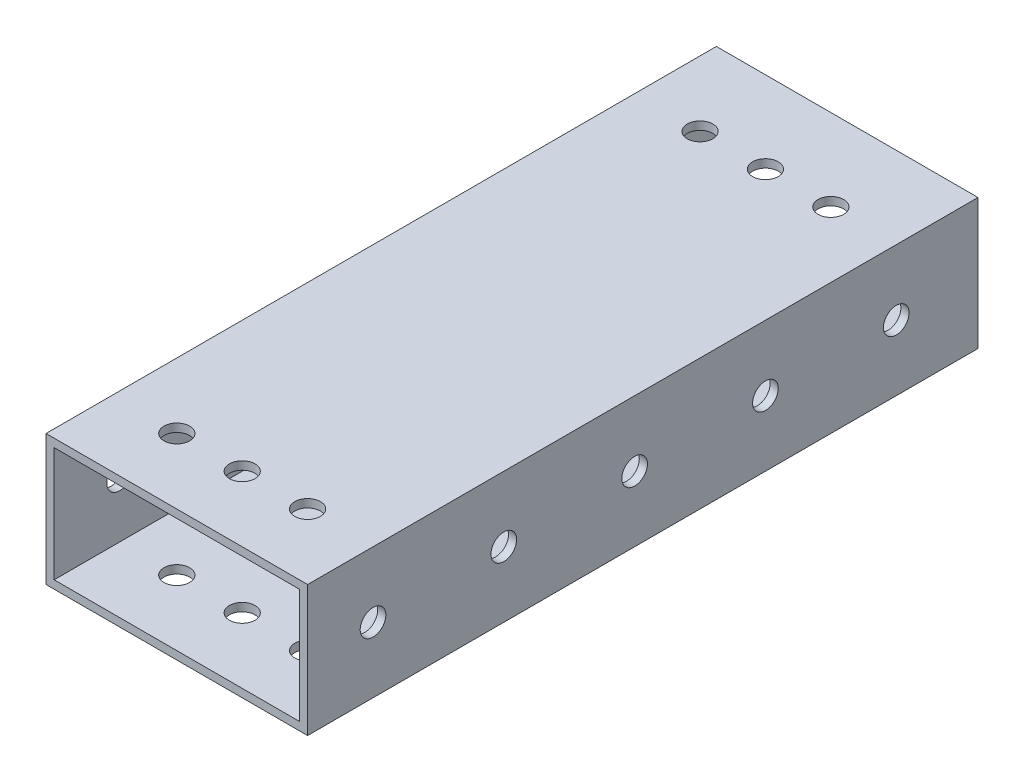
from build123d import *

# Parameters (mm, degrees)
SKETCH1_W           = 50.8
SKETCH1_H           = 25.4
SKETCH1_W_2         = 47.625
SKETCH1_H_2         = 22.225
BOSS_EXTRUDE1_DEPTH = 130.175
SKETCH2_R           = 2.4892
CUT_EXTRUDE1_DEPTH  = 136.04018152
SKETCH3_R           = 2.4892
CUT_EXTRUDE2_DEPTH  = 141.312011692


with BuildPart() as part:
    # Sketch1 → Boss-Extrude1 (new body)
    with BuildSketch(Plane.XY):
        Rectangle(SKETCH1_W, SKETCH1_H)
        Rectangle(SKETCH1_W_2, SKETCH1_H_2, mode=Mode.SUBTRACT)
    extrude(amount=BOSS_EXTRUDE1_DEPTH)

    # Sketch2 → Cut-Extrude1 (cut, through all)
    with BuildSketch(Plane(origin=(0, 12.7, 0), x_dir=(1, 0, 0), z_dir=(0, 1, 0))):
        with Locations((-12.7, -15.875)):
            Circle(SKETCH2_R)
        with Locations((0, -15.875)):
            Circle(SKETCH2_R)
        with Locations((12.7, -15.875)):
            Circle(SKETCH2_R)
        with Locations((-12.7, -117.475)):
            Circle(SKETCH2_R)
        with Locations((0, -117.475)):
            Circle(SKETCH2_R)
        with Locations((12.7, -117.475)):
            Circle(SKETCH2_R)
    extrude(amount=-CUT_EXTRUDE1_DEPTH, mode=Mode.SUBTRACT)

    # Sketch3 → Cut-Extrude2 (cut, through all)
    with BuildSketch(Plane(origin=(25.4, 0, 0), x_dir=(0, 0, -1), z_dir=(1, 0, 0))):
        with Locations((-117.475, 0)):
            Circle(SKETCH3_R)
        with Locations((-92.075, 0)):
            Circle(SKETCH3_R)
        with Locations((-66.675, 0)):
            Circle(SKETCH3_R)
        with Locations((-41.275, 0)):
            Circle(SKETCH3_R)
        with Locations((-15.875, 0)):
            Circle(SKETCH3_R)
    extrude(amount=-CUT_EXTRUDE2_DEPTH, mode=Mode.SUBTRACT)


solid = part.part
